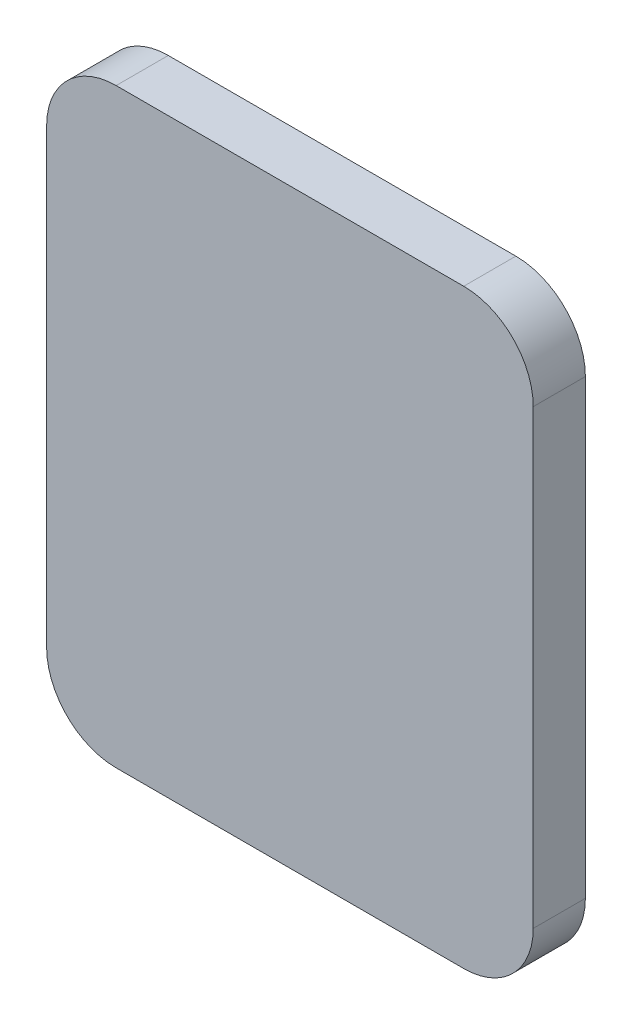
from build123d import *

# Parameters (mm, degrees)
BOSS_EXTRUDE1_DEPTH      = 5
BOSS_EXTRUDE1_DEPTH_BACK = 10
SKETCH1_W                = 140
SKETCH1_H                = 170
FILLET1_R                = 20
SHELL2_T                 = -4
SHELL2_THICKNESS_2_DEPTH = 1
SKETCH2_R                = 2.1
CUT_EXTRUDE1_DEPTH       = 4.5


with BuildPart() as part:
    # Sketch1 → Boss-Extrude1 (new, two sides: drawn at the far end of the back side and taken through both)
    with BuildSketch(Plane.XY.offset(-BOSS_EXTRUDE1_DEPTH_BACK)):
        with Locations((7.5, 40.5)):
            Rectangle(SKETCH1_W, SKETCH1_H)
    extrude(amount=BOSS_EXTRUDE1_DEPTH + BOSS_EXTRUDE1_DEPTH_BACK)

    # Fillet1
    fillet1_edges = [part.edges().sort_by_distance(p)[0] for p in [
        (-62.5, 125.5, -2.5),
        (77.5, 125.5, -2.5),
        (77.5, -44.5, -2.5),
        (-62.5, -44.5, -2.5),
    ]]
    fillet(fillet1_edges, radius=FILLET1_R)

    # Shell2
    shell2_openings = [part.faces().sort_by_distance(p)[0] for p in [
        (7.5, 40.5, -10),
    ]]
    offset(amount=SHELL2_T, openings=shell2_openings, kind=Kind.INTERSECTION)

    # Shell2 thickness 2 face (on inner face of the shell) → Shell2 thickness 2 (add)
    with BuildSketch(Plane(origin=(7.5, 40.5, 1), x_dir=(1, 0, 0), z_dir=(0, 0, 1))):
        with BuildLine():
            ThreePointArc((-66, 65), (-61.313708499, 76.313708499), (-50, 81))
            Line((-50, 81), (50, 81))
            ThreePointArc((50, 81), (61.313708499, 76.313708499), (66, 65))
            Line((66, 65), (66, -65))
            ThreePointArc((66, -65), (61.313708499, -76.313708499), (50, -81))
            Line((50, -81), (-50, -81))
            ThreePointArc((-50, -81), (-61.313708499, -76.313708499), (-66, -65))
            Line((-66, -65), (-66, 65))
        make_face()
    extrude(amount=-SHELL2_THICKNESS_2_DEPTH)

    # Sketch2 → Cut-Extrude1 (cut)
    with BuildSketch(Plane(origin=(0, 0, 0), x_dir=(-1, 0, 0), z_dir=(0, 0, -1))):
        with Locations((0, -23)):
            Circle(SKETCH2_R)
        Circle(SKETCH2_R)
        with Locations((-58, 0)):
            Circle(SKETCH2_R)
        with Locations((-58, -23)):
            Circle(SKETCH2_R)
    extrude(amount=-CUT_EXTRUDE1_DEPTH, mode=Mode.SUBTRACT)


solid = part.part
